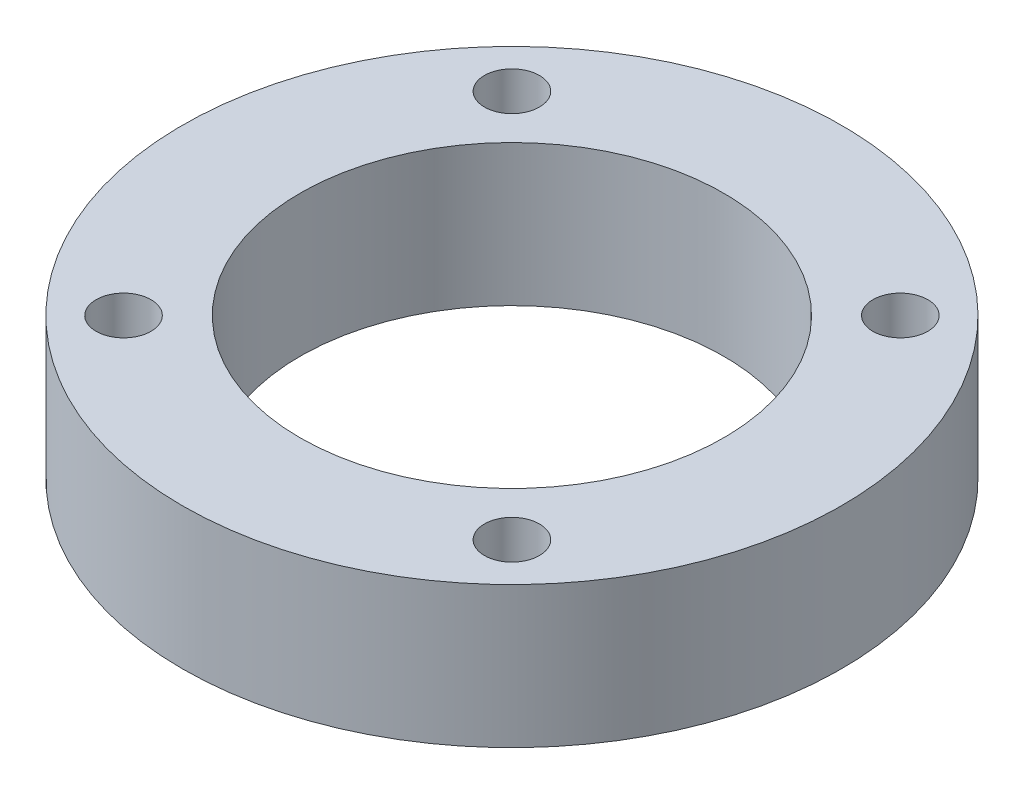
from build123d import *

# Parameters (mm, degrees)
SKETCH_1_R      = 21
SKETCH_1_R_2    = 13.5
SKETCH_1_R_3    = 1.75
EXTRUDE_1_DEPTH = 9


with BuildPart() as part:
    # ｽｹｯﾁ1 → ﾎﾞｽ - 押し出し1 (new body)
    with BuildSketch(Plane(origin=(0, 0, 0), x_dir=(1, 0, 0), z_dir=(0, 1, 0))):
        Circle(SKETCH_1_R)
        Circle(SKETCH_1_R_2, mode=Mode.SUBTRACT)
        with Locations((12.374368671, 12.374368671)):
            Circle(SKETCH_1_R_3, mode=Mode.SUBTRACT)
        with Locations((12.374368671, -12.374368671)):
            Circle(SKETCH_1_R_3, mode=Mode.SUBTRACT)
        with Locations((-12.374368671, -12.374368671)):
            Circle(SKETCH_1_R_3, mode=Mode.SUBTRACT)
        with Locations((-12.374368671, 12.374368671)):
            Circle(SKETCH_1_R_3, mode=Mode.SUBTRACT)
    extrude(amount=EXTRUDE_1_DEPTH)


solid = part.part
